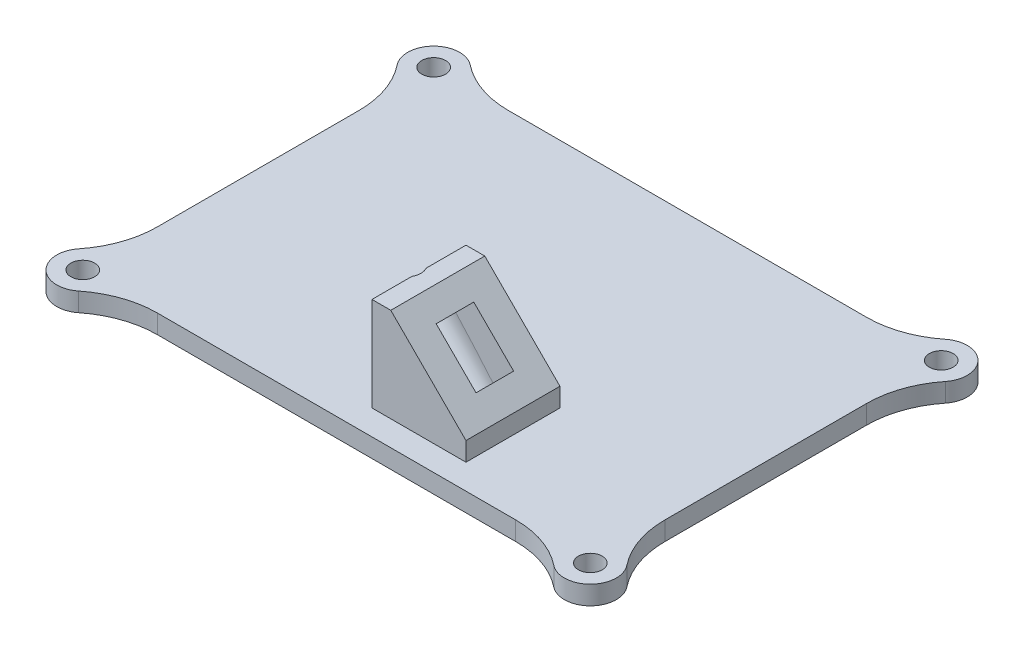
from build123d import *

# Parameters (mm, degrees)
BOSS_EXTRUDE1_DEPTH     = 3
FILLET1_R               = 15
SKETCH2_R               = 1.9
CUT_EXTRUDE1_DEPTH      = 3
SKETCH3_W               = 15
SKETCH3_H               = 15
BOSS_EXTRUDE2_DEPTH     = 15
CHAMFER1_SIZE           = 12
F_3DSKETCH1_R           = 3.25
CUT_EXTRUDE2_DEPTH      = 12
CUT_EXTRUDE2_TAPER      = 1
CUT_EXTRUDE2_DEPTH_BACK = 12
SKETCH4_W               = 6
SKETCH4_H               = 9
CUT_EXTRUDE3_DEPTH      = 5


with BuildPart() as part:
    # Sketch1 → Boss-Extrude1 (new body)
    with BuildSketch(Plane(origin=(0, 0, 0), x_dir=(1, 0, 0), z_dir=(0, 1, 0))):
        with BuildLine():
            ThreePointArc((0, 4.15), (-2.934493142, -2.934493142), (4.15, 0))
            Line((4.15, 0), (76.85, 0))
            ThreePointArc((76.85, 0), (83.934493142, -2.934493142), (81, 4.15))
            Line((81, 4.15), (81, 51.85))
            ThreePointArc((81, 51.85), (83.934493142, 58.934493142), (76.85, 56))
            Line((76.85, 56), (4.15, 56))
            ThreePointArc((4.15, 56), (-2.934493142, 58.934493142), (0, 51.85))
            Line((0, 51.85), (0, 4.15))
        make_face()
    extrude(amount=BOSS_EXTRUDE1_DEPTH)

    # Fillet1
    fillet1_edges = [part.edges().sort_by_distance(p)[0] for p in [
        (0, 1.5, -51.85),
        (4.15, 1.5, -56),
        (76.85, 1.5, -56),
        (81, 1.5, -51.85),
        (81, 1.5, -4.15),
        (76.85, 1.5, 0),
        (0, 1.5, -4.15),
        (4.15, 1.5, 0),
    ]]
    fillet(fillet1_edges, radius=FILLET1_R)

    # Sketch2 → Cut-Extrude1 (cut)
    with BuildSketch(Plane(origin=(0, 3, 0), x_dir=(1, 0, 0), z_dir=(0, 1, 0))):
        with Locations((0, 56)):
            Circle(SKETCH2_R)
        with Locations((81, 56)):
            Circle(SKETCH2_R)
        with Locations((81, 0)):
            Circle(SKETCH2_R)
        Circle(SKETCH2_R)
    extrude(amount=-CUT_EXTRUDE1_DEPTH, mode=Mode.SUBTRACT)

    # Sketch3 → Boss-Extrude2 (add)
    with BuildSketch(Plane(origin=(0, 3, 0), x_dir=(1, 0, 0), z_dir=(0, 1, 0))):
        with Locations((49.654495899, 11.5)):
            Rectangle(SKETCH3_W, SKETCH3_H)
    extrude(amount=BOSS_EXTRUDE2_DEPTH)

    # Chamfer1
    chamfer1_edges = [part.edges().sort_by_distance(p)[0] for p in [
        (57.154495899, 18, -11.5),
    ]]
    chamfer(chamfer1_edges, length=CHAMFER1_SIZE)

    # 3DSketch1 → Cut-Extrude2 (cut, two sides)
    with BuildSketch(Plane(origin=(42.154495899, 13.701446828, -11.5), x_dir=(0, 0, -1), z_dir=(0.7071067811865464, -0.7071067811865488, 0))) as cut_extrude2_sk:
        Circle(F_3DSKETCH1_R)
    extrude(amount=CUT_EXTRUDE2_DEPTH, taper=CUT_EXTRUDE2_TAPER, mode=Mode.SUBTRACT)
    extrude(cut_extrude2_sk.sketch, amount=-CUT_EXTRUDE2_DEPTH_BACK, mode=Mode.SUBTRACT)

    # Sketch4 → Cut-Extrude3 (cut)
    with BuildSketch(Plane(origin=(31.57724795, 31.57724795, 0), x_dir=(0, 0, -1), z_dir=(0.7071067811865487, 0.7071067811865465, 0))):
        with Locations((11.5, -27.579807846)):
            Rectangle(SKETCH4_W, SKETCH4_H)
    extrude(amount=-CUT_EXTRUDE3_DEPTH, mode=Mode.SUBTRACT)


solid = part.part
